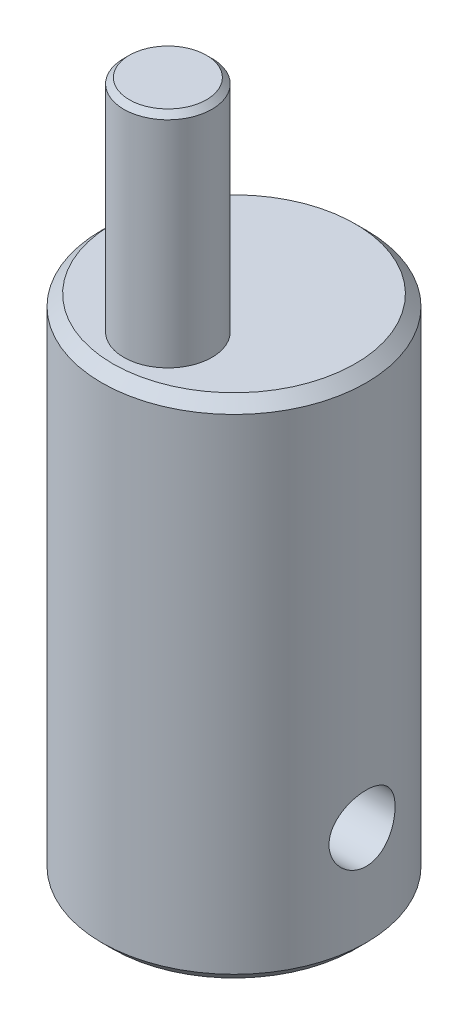
from build123d import *

# Parameters (mm, degrees)
SKETCH1_R               = 6
BOSS_EXTRUDE1_DEPTH     = 23
SKETCH2_R               = 2
BOSS_EXTRUDE2_DEPTH     = 10
CUT_EXTRUDE1_DEPTH      = 35.073450075
CUT_EXTRUDE1_DEPTH_BACK = 35.073450075
SKETCH3_R               = 1.5
CHAMFER1_SIZE           = 0.25
CHAMFER2_SIZE           = 0.5


with BuildPart() as part:
    # Sketch1 → Boss-Extrude1 (new body)
    with BuildSketch(Plane(origin=(0, 0, 0), x_dir=(1, 0, 0), z_dir=(0, 1, 0))):
        Circle(SKETCH1_R)
    extrude(amount=BOSS_EXTRUDE1_DEPTH)

    # Sketch2 → Boss-Extrude2 (add)
    with BuildSketch(Plane(origin=(0, 23, 0), x_dir=(1, 0, 0), z_dir=(0, 1, 0))):
        with Locations((0, -3)):
            Circle(SKETCH2_R)
    extrude(amount=BOSS_EXTRUDE2_DEPTH)

    # Sketch3 → Cut-Extrude1 (cut, two sides: drawn at the far end of the back side and taken through both)
    with BuildSketch(Plane(origin=(0, 0, 0), x_dir=(0, 0, -1), z_dir=(1, 0, 0)).offset(-CUT_EXTRUDE1_DEPTH_BACK)):
        with Locations((0, 5)):
            Circle(SKETCH3_R)
    extrude(amount=CUT_EXTRUDE1_DEPTH + CUT_EXTRUDE1_DEPTH_BACK, mode=Mode.SUBTRACT)

    # Chamfer1
    chamfer1_edges = [part.edges().sort_by_distance(p)[0] for p in [
        (-2, 33, 3),
    ]]
    chamfer(chamfer1_edges, length=CHAMFER1_SIZE)

    # Chamfer2
    chamfer2_edges = [part.edges().sort_by_distance(p)[0] for p in [
        (-6, 0, 0),
        (-6, 23, 0),
    ]]
    chamfer(chamfer2_edges, length=CHAMFER2_SIZE)


solid = part.part
